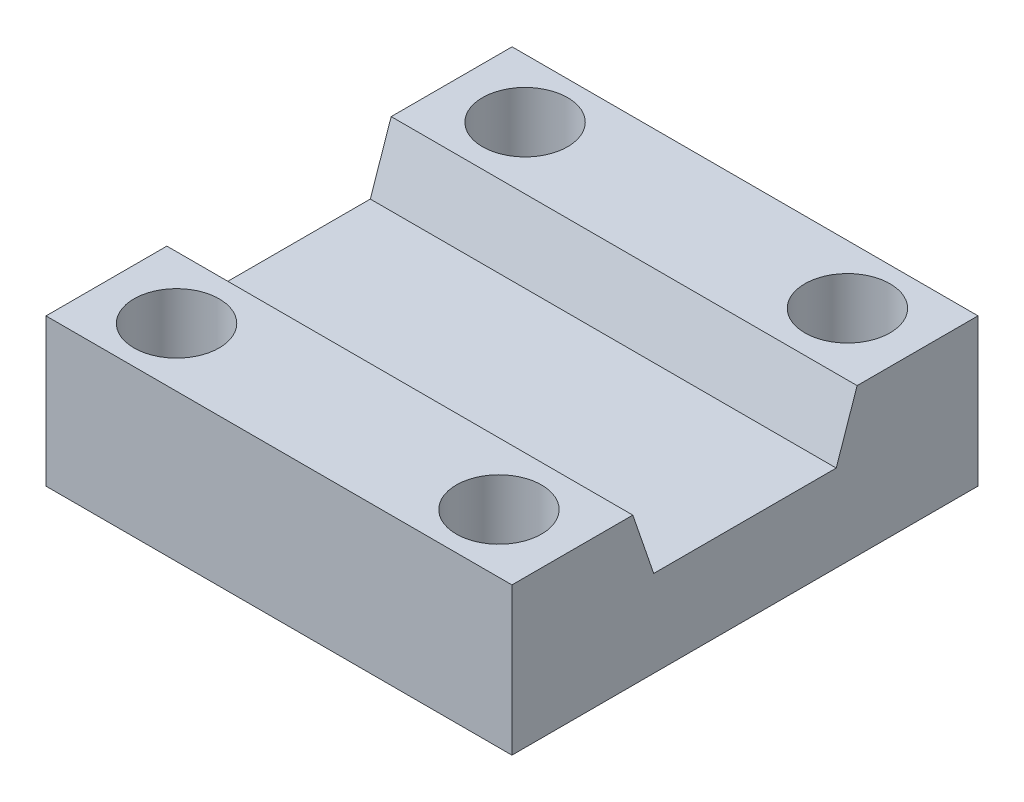
from build123d import *

# Parameters (mm, degrees)
SKETCH1_W                            = 38.29
SKETCH1_H                            = 38.3
BOSS_EXTRUDE1_DEPTH                  = 12.12
CUT_EXTRUDE1_DEPTH                   = 45.494280531
M8X1_0_TAPPED_HOLE2_D                = 7
MIRROR1_AT_THE_SECOND_PLANE_COPY_1_D = 7


with BuildPart() as part:
    # Sketch1 → Boss-Extrude1 (new body)
    with BuildSketch(Plane(origin=(0, 0, 0), x_dir=(1, 0, 0), z_dir=(0, 1, 0))):
        Rectangle(SKETCH1_W, SKETCH1_H)
    extrude(amount=BOSS_EXTRUDE1_DEPTH)

    # Sketch2 → Cut-Extrude1 (cut, through all)
    with BuildSketch(Plane(origin=(19.145, 0, 0), x_dir=(0, 0, -1), z_dir=(1, 0, 0))):
        Polygon((-9.216421688, 12.12), (-7.5, 7.11), (7.5, 7.11), (9.216421688, 12.12), align=None)
    extrude(amount=-CUT_EXTRUDE1_DEPTH, mode=Mode.SUBTRACT)

    # M8x1.0 Tapped Hole2 (through all)
    with Locations(Plane(origin=(0, 12.12, 0), x_dir=(1, 0, 0), z_dir=(0, 1, 0))):
        with Locations((-13.246050664, 14.31934726)):
            m8x1_0_tapped_hole2 = Hole(M8X1_0_TAPPED_HOLE2_D / 2)

    # Mirror1: M8x1.0 Tapped Hole2 across plane
    add(m8x1_0_tapped_hole2.mirror(Plane.XY), mode=Mode.SUBTRACT)

    # Mirror1 at the second plane: M8x1.0 Tapped Hole2 across plane
    add(m8x1_0_tapped_hole2.mirror(Plane(origin=(0, 0, 0), x_dir=(0, 0, 1), z_dir=(1, 0, 0))), mode=Mode.SUBTRACT)

    # Mirror1 at the second plane copy 1 (through all)
    with Locations(Plane(origin=(0, 12.12, 0), x_dir=(-1, 0, 0), z_dir=(0, 1, 0))):
        with Locations((-13.246050664, 14.31934726)):
            Hole(MIRROR1_AT_THE_SECOND_PLANE_COPY_1_D / 2)


solid = part.part
